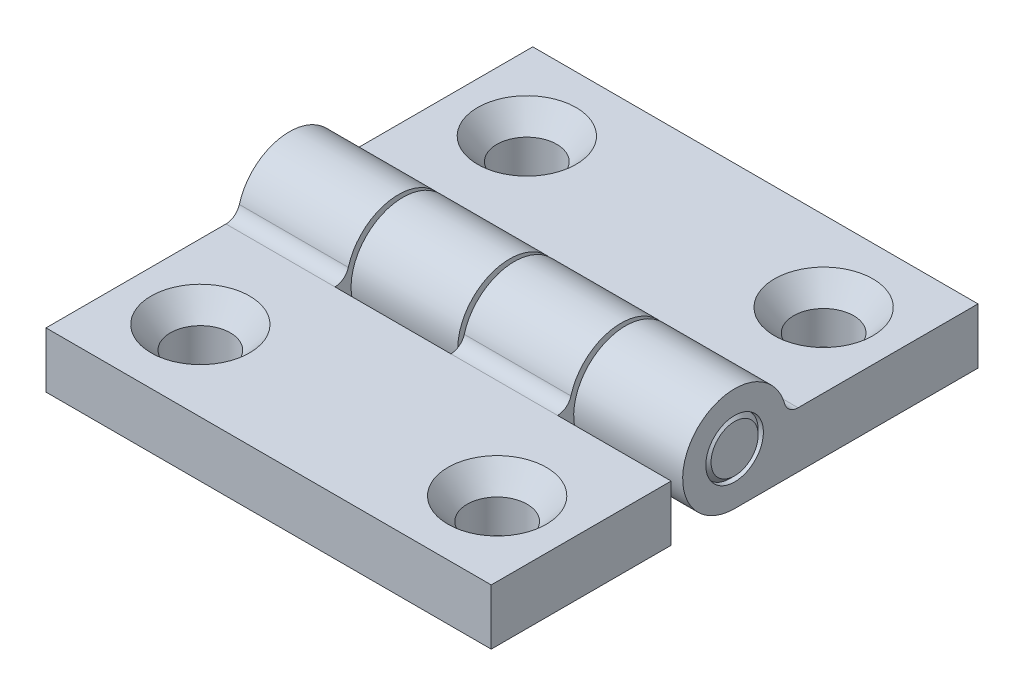
from build123d import *

# Parameters (mm, degrees)
SKETCH3_R               = 2.4638
BOSS_EXTRUDE1_DEPTH     = 19.05
SKETCH4_W               = 9.525
SKETCH4_H               = 9.875085462
CUT_EXTRUDE1_DEPTH      = 29.573871089
LPATTERN1_COUNT         = 2
LPATTERN1_PITCH         = 19.05
CUT_EXTRUDE2_DEPTH      = 29.624980179
CUT_EXTRUDE2_DEPTH_BACK = 29.624980179
SKETCH5_W               = 0.1984375
SKETCH5_H               = 9.875085462
SKETCH6_R               = 2.5638125
CUT_EXTRUDE3_DEPTH      = 29.624980179
CUT_EXTRUDE5_DEPTH      = 1.190625
FILLET1_R               = 0.1984375
FILLET2_R               = 0.396875
CIRPATTERN1_COUNT       = 2
SKETCH9_R               = 2.413
BOSS_EXTRUDE2_DEPTH     = 19.05
CHAMFER1_SIZE           = 0.396875
CUT_EXTRUDE6_START      = -6.35
CUT_EXTRUDE6_DEPTH      = 6.35


# Read off the part's stored shape, not the designer's step: Cut-Extrude6
with BuildPart() as part:
    # Sketch3 → Boss-Extrude1 (new, symmetric)
    with BuildSketch(Plane(origin=(0, 0, 0), x_dir=(0, 0, -1), z_dir=(1, 0, 0))):
        with BuildLine():
            Line((0, -4.445), (-20.828, -4.445))
            Line((-20.828, -4.445), (-20.828, 0.3175))
            Line((-20.828, 0.3175), (-5.430085462, 0.3175))
            ThreePointArc((-5.430085462, 0.3175), (-4.709587931, 0.560247794), (-4.282884308, 1.189507042))
            ThreePointArc((-4.282884308, 1.189507042), (3.53874157, 2.689857449), (0, -4.445))
        make_face()
        with Locations(Location((0, 0, 0), (0, 0, 180))):
            Circle(SKETCH3_R, mode=Mode.SUBTRACT)
    extrude(amount=BOSS_EXTRUDE1_DEPTH, both=True)

    # Sketch4 → Cut-Extrude1 (cut, symmetric)
    with BuildSketch(Plane(origin=(0, 0, 0), x_dir=(1, 0, 0), z_dir=(0, 1, 0))):
        with Locations((-4.7625, -0.492542731)):
            Rectangle(SKETCH4_W, SKETCH4_H)
    cut_extrude1 = extrude(amount=CUT_EXTRUDE1_DEPTH, both=True, mode=Mode.SUBTRACT)

    # LPattern1: Cut-Extrude1 ×2
    with Locations(*[(i * LPATTERN1_PITCH, 0, 0) for i in range(1, LPATTERN1_COUNT)]):
        add(cut_extrude1, mode=Mode.SUBTRACT)

    # Sketch5 → Cut-Extrude2 (cut, two sides: drawn at the far end of the back side and taken through both)
    with BuildSketch(Plane(origin=(0, 0.3175, 0), x_dir=(1, 0, 0), z_dir=(0, 1, 0)).offset(-CUT_EXTRUDE2_DEPTH_BACK)):
        with Locations((-9.62421875, -0.492542731)):
            Rectangle(SKETCH5_W, SKETCH5_H)
        with Locations((0.09921875, -0.492542731)):
            Rectangle(SKETCH5_W, SKETCH5_H)
        with Locations((9.42578125, -0.492542731)):
            Rectangle(SKETCH5_W, SKETCH5_H)
    extrude(amount=CUT_EXTRUDE2_DEPTH + CUT_EXTRUDE2_DEPTH_BACK, mode=Mode.SUBTRACT)

    # Sketch6 → Cut-Extrude3 (cut, through all)
    with BuildSketch(Plane(origin=(0, 0.3175, 0), x_dir=(1, 0, 0), z_dir=(0, 1, 0))):
        with Locations(Location((12.7, -13.97, 0), (0, 0, 270))):
            Circle(SKETCH6_R)
        with Locations(Location((-12.7, -13.97, 0), (0, 0, 270))):
            Circle(SKETCH6_R)
    extrude(amount=-CUT_EXTRUDE3_DEPTH, mode=Mode.SUBTRACT)

    # Cut-Extrude4 cone 1 section (through the dimple's axis) → Cut-Extrude4 (revolve, cut)
    with BuildSketch(Plane(origin=(-12.7, 0.3175, 13.97), x_dir=(0, 0, 1), z_dir=(1, 0, 0))):
        Polygon((0, 0), (4.2164, 0), (0, 4.850413352), align=None)
    revolve(axis=Axis((-12.7, 0.3175, 13.97), (0, -1, 0)), mode=Mode.SUBTRACT)

    # Cut-Extrude4 cone 2 section (through the dimple's axis) → Cut-Extrude4 cone 2 (revolve, cut)
    with BuildSketch(Plane(origin=(12.7, 0.3175, 13.97), x_dir=(0, 0, 1), z_dir=(1, 0, 0))):
        Polygon((0, 0), (4.2164, 0), (0, 4.850413352), align=None)
    revolve(axis=Axis((12.7, 0.3175, 13.97), (0, -1, 0)), mode=Mode.SUBTRACT)

    # Sketch8 → Cut-Extrude5 (cut)
    with BuildSketch(Plane.XZ.offset(4.445)):
        with BuildLine():
            Line((9.115088955, 18.1864), (-9.115088955, 18.1864))
            ThreePointArc((-9.115088955, 18.1864), (-9.816352043, 17.722517563), (-9.663799829, 16.895665306))
            ThreePointArc((-9.663799829, 16.895665306), (-8.592181168, 13.019287951), (-11.257906268, 10.007880034))
            ThreePointArc((-11.257906268, 10.007880034), (-12.237514585, 8.311148657), (-10.736667569, 7.05178848))
            Line((-10.736667569, 7.05178848), (10.736667569, 7.05178848))
            ThreePointArc((10.736667569, 7.05178848), (12.237514585, 8.311148657), (11.257906268, 10.007880034))
            ThreePointArc((11.257906268, 10.007880034), (8.592181168, 13.019287951), (9.663799829, 16.895665306))
            ThreePointArc((9.663799829, 16.895665306), (9.816352043, 17.722517563), (9.115088955, 18.1864))
        make_face()
    extrude(amount=-CUT_EXTRUDE5_DEPTH, mode=Mode.SUBTRACT)

    # Fillet1
    fillet1_edges = [part.edges().sort_by_distance(p)[0] for p in [
        (12.237514585, -4.445, 8.311148657),
        (8.592181168, -4.445, 13.019287951),
        (9.816352043, -4.445, 17.722517563),
        (0, -4.445, 18.1864),
        (-9.816352043, -4.445, 17.722517563),
        (-8.592181168, -4.445, 13.019287951),
        (-12.237514585, -4.445, 8.311148657),
        (0, -4.445, 7.05178848),
    ]]
    fillet(fillet1_edges, radius=FILLET1_R)

    # Fillet2
    fillet2_edges = [part.edges().sort_by_distance(p)[0] for p in [
        (12.237514585, -3.254375, 8.311148657),
        (0, -3.254375, 7.05178848),
        (-12.237514585, -3.254375, 8.311148657),
        (-8.592181168, -3.254375, 13.019287951),
        (-9.816352043, -3.254375, 17.722517563),
        (0, -3.254375, 18.1864),
        (9.816352043, -3.254375, 17.722517563),
        (8.592181168, -3.254375, 13.019287951),
    ]]
    fillet(fillet2_edges, radius=FILLET2_R)


with BuildPart() as cirpattern1_1:
    # CirPattern1: pattern copy
    add(part.part.rotate(Axis((0, 0, 0), (0, 1, 0)), 1 * 360 / CIRPATTERN1_COUNT))


with BuildPart() as body_3:
    # Sketch9 → Boss-Extrude2 (new, symmetric)
    with BuildSketch(Plane(origin=(0, 0, 0), x_dir=(0, 0, -1), z_dir=(1, 0, 0))):
        with Locations(Location((0, 0, 0), (0, 0, 180))):
            Circle(SKETCH9_R)
    extrude(amount=BOSS_EXTRUDE2_DEPTH, both=True)

    # Chamfer1
    chamfer1_edges = [body_3.edges().sort_by_distance(p)[0] for p in [
        (19.05, 0, -2.413),
    ]]
    chamfer(chamfer1_edges, length=CHAMFER1_SIZE)

    # Cut-Extrude6 outline → Cut-Extrude6 (cut)
    with BuildSketch(Plane.ZY.offset(19.05).offset(CUT_EXTRUDE6_START)):
        with BuildLine():
            ThreePointArc((-0.377476364, -2.383291966), (0, -2.413), (0.377476364, -2.383291966))
            Line((0.377476364, -2.383291966), (0, -2.005815602))
            Line((0, -2.005815602), (-0.377476364, -2.383291966))
        make_face()
        with BuildLine():
            Line((0.619831109, -1.907643998), (0.377476364, -2.383291966))
            ThreePointArc((0.377476364, -2.383291966), (0.745658007, -2.294899374), (1.095479076, -2.149998743))
            Line((1.095479076, -2.149998743), (0.619831109, -1.907643998))
        make_face()
        with BuildLine():
            ThreePointArc((-1.095479076, -2.149998743), (-0.745658007, -2.294899374), (-0.377476364, -2.383291966))
            Line((-0.377476364, -2.383291966), (-0.619831109, -1.907643998))
            Line((-0.619831109, -1.907643998), (-1.095479076, -2.149998743))
        make_face()
        with BuildLine():
            Line((1.17898883, -1.622738909), (1.095479076, -2.149998743))
            ThreePointArc((1.095479076, -2.149998743), (1.418325814, -1.952158007), (1.706248663, -1.706248663))
            Line((1.706248663, -1.706248663), (1.17898883, -1.622738909))
        make_face()
        with BuildLine():
            ThreePointArc((-1.706248663, -1.706248663), (-1.418325814, -1.952158007), (-1.095479076, -2.149998743))
            Line((-1.095479076, -2.149998743), (-1.17898883, -1.622738909))
            Line((-1.17898883, -1.622738909), (-1.706248663, -1.706248663))
        make_face()
        with BuildLine():
            Line((1.622738909, -1.17898883), (1.706248663, -1.706248663))
            ThreePointArc((1.706248663, -1.706248663), (1.952158007, -1.418325814), (2.149998743, -1.095479076))
            Line((2.149998743, -1.095479076), (1.622738909, -1.17898883))
        make_face()
        with BuildLine():
            ThreePointArc((-2.149998743, -1.095479076), (-1.952158007, -1.418325814), (-1.706248663, -1.706248663))
            Line((-1.706248663, -1.706248663), (-1.622738909, -1.17898883))
            Line((-1.622738909, -1.17898883), (-2.149998743, -1.095479076))
        make_face()
        with BuildLine():
            Line((1.907643998, -0.619831109), (2.149998743, -1.095479076))
            ThreePointArc((2.149998743, -1.095479076), (2.294899374, -0.745658007), (2.383291966, -0.377476364))
            Line((2.383291966, -0.377476364), (1.907643998, -0.619831109))
        make_face()
        with BuildLine():
            ThreePointArc((-2.383291966, -0.377476364), (-2.294899374, -0.745658007), (-2.149998743, -1.095479076))
            Line((-2.149998743, -1.095479076), (-1.907643998, -0.619831109))
            Line((-1.907643998, -0.619831109), (-2.383291966, -0.377476364))
        make_face()
        with BuildLine():
            Line((2.005815602, 0), (2.383291966, -0.377476364))
            ThreePointArc((2.383291966, -0.377476364), (2.413, 0), (2.383291966, 0.377476364))
            Line((2.383291966, 0.377476364), (2.005815602, 0))
        make_face()
        with BuildLine():
            ThreePointArc((-2.383291966, 0.377476364), (-2.413, 0), (-2.383291966, -0.377476364))
            Line((-2.383291966, -0.377476364), (-2.005815602, 0))
            Line((-2.005815602, 0), (-2.383291966, 0.377476364))
        make_face()
        with BuildLine():
            ThreePointArc((-2.149998743, 1.095479076), (-2.294899374, 0.745658007), (-2.383291966, 0.377476364))
            Line((-2.383291966, 0.377476364), (-1.907643998, 0.619831109))
            Line((-1.907643998, 0.619831109), (-2.149998743, 1.095479076))
        make_face()
        with BuildLine():
            Line((1.907643998, 0.619831109), (2.383291966, 0.377476364))
            ThreePointArc((2.383291966, 0.377476364), (2.294899374, 0.745658007), (2.149998743, 1.095479076))
            Line((2.149998743, 1.095479076), (1.907643998, 0.619831109))
        make_face()
        with BuildLine():
            ThreePointArc((-1.706248663, 1.706248663), (-1.952158007, 1.418325814), (-2.149998743, 1.095479076))
            Line((-2.149998743, 1.095479076), (-1.622738909, 1.17898883))
            Line((-1.622738909, 1.17898883), (-1.706248663, 1.706248663))
        make_face()
        with BuildLine():
            Line((1.622738909, 1.17898883), (2.149998743, 1.095479076))
            ThreePointArc((2.149998743, 1.095479076), (1.952158007, 1.418325814), (1.706248663, 1.706248663))
            Line((1.706248663, 1.706248663), (1.622738909, 1.17898883))
        make_face()
        with BuildLine():
            ThreePointArc((-1.095479076, 2.149998743), (-1.418325814, 1.952158007), (-1.706248663, 1.706248663))
            Line((-1.706248663, 1.706248663), (-1.17898883, 1.622738909))
            Line((-1.17898883, 1.622738909), (-1.095479076, 2.149998743))
        make_face()
        with BuildLine():
            Line((1.17898883, 1.622738909), (1.706248663, 1.706248663))
            ThreePointArc((1.706248663, 1.706248663), (1.418325814, 1.952158007), (1.095479076, 2.149998743))
            Line((1.095479076, 2.149998743), (1.17898883, 1.622738909))
        make_face()
        with BuildLine():
            ThreePointArc((-0.377476364, 2.383291966), (-0.745658007, 2.294899374), (-1.095479076, 2.149998743))
            Line((-1.095479076, 2.149998743), (-0.619831109, 1.907643998))
            Line((-0.619831109, 1.907643998), (-0.377476364, 2.383291966))
        make_face()
        with BuildLine():
            Line((0.619831109, 1.907643998), (1.095479076, 2.149998743))
            ThreePointArc((1.095479076, 2.149998743), (0.745658007, 2.294899374), (0.377476364, 2.383291966))
            Line((0.377476364, 2.383291966), (0.619831109, 1.907643998))
        make_face()
        with BuildLine():
            ThreePointArc((0.377476364, 2.383291966), (0, 2.413), (-0.377476364, 2.383291966))
            Line((-0.377476364, 2.383291966), (0, 2.005815602))
            Line((0, 2.005815602), (0.377476364, 2.383291966))
        make_face()
    extrude(amount=CUT_EXTRUDE6_DEPTH, mode=Mode.SUBTRACT)


solid = Compound([part.part, cirpattern1_1.part, body_3.part])
